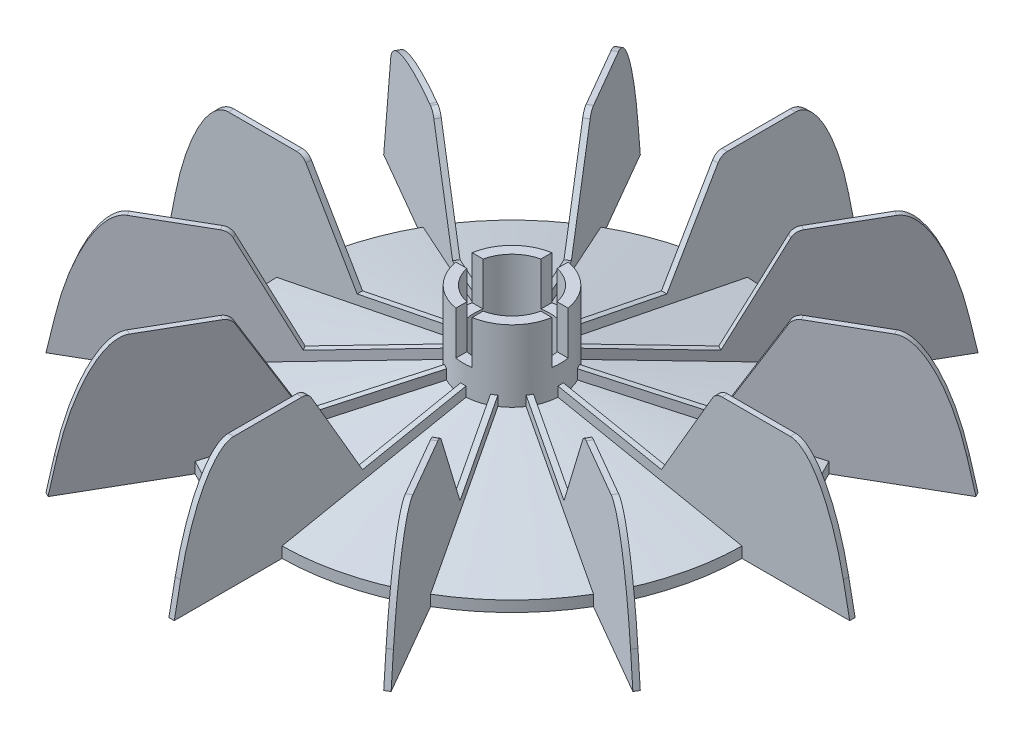
from build123d import *

# Parameters (mm, degrees)
SKETCH2_R            = 43
SKETCH2_R_2          = 7
BOSS_EXTRUDE1_DEPTH  = 10
SKETCH3_R            = 9
SKETCH3_R_2          = 7
BOSS_EXTRUDE2_DEPTH  = 12
CHAMFER1_SIZE        = 8
CHAMFER1_SIZE_2      = 40
BOSS_EXTRUDE12_DEPTH = 0.5
CIRPATTERN1_COUNT    = 12
FILLET1_START        = -0.5
FILLET1_DEPTH        = 1
FILLET1_2_DEPTH      = 1
FILLET1_3_DEPTH      = 1
FILLET1_4_DEPTH      = 1
FILLET1_5_DEPTH      = 1
FILLET1_6_DEPTH      = 1
FILLET2_R            = 2
CHAMFER2_SIZE        = 36.011878112
CHAMFER2_SIZE_2      = 7
SKETCH6_W            = 4.524645718
SKETCH6_H            = 3
CUT_EXTRUDE1_DEPTH   = 8
CIRPATTERN2_COUNT    = 4


with BuildPart() as part:
    # Sketch2 → Boss-Extrude1 (new body)
    with BuildSketch(Plane(origin=(0, 0, 0), x_dir=(1, 0, 0), z_dir=(0, 1, 0))):
        with Locations(Location((0, 0, 0), (0, 0, 270))):
            Circle(SKETCH2_R)
        with Locations(Location((0, 0, 0), (0, 0, 270))):
            Circle(SKETCH2_R_2, mode=Mode.SUBTRACT)
    extrude(amount=BOSS_EXTRUDE1_DEPTH)

    # Sketch3 → Boss-Extrude2 (add)
    with BuildSketch(Plane(origin=(0, 10, 0), x_dir=(1, 0, 0), z_dir=(0, 1, 0))):
        with Locations(Location((0, 0, 0), (0, 0, 270))):
            Circle(SKETCH3_R)
        with Locations(Location((0, 0, 0), (0, 0, 270))):
            Circle(SKETCH3_R_2, mode=Mode.SUBTRACT)
    extrude(amount=BOSS_EXTRUDE2_DEPTH)

    # Chamfer1
    # the kernel refuses this chamfer: 40, 8 mm, written as the material it takes off along each edge
    with BuildSketch(Plane(origin=(0, 10, 0), x_dir=(0, 0, 1), z_dir=(-1, 0, 0))) as chamfer1_piece_1_section:
        Polygon((43, -CHAMFER1_SIZE), (43 - CHAMFER1_SIZE_2, 0), (43, 0), align=None)
    chamfer1_piece_1 = revolve(axis=Axis((0, 10, 0), (0, 1, 0)), mode=Mode.PRIVATE)
    chamfer1_piece_1 = chamfer1_piece_1 - Plane(origin=(0, 10, 0), x_dir=(0, 0, 1), z_dir=(0, -1, 0)) * Cylinder(9, 172, mode=Mode.PRIVATE)
    add(chamfer1_piece_1, mode=Mode.SUBTRACT)

    # Sketch4 → Boss-Extrude12 (add, symmetric)
    with BuildSketch(Plane.XY):
        Polygon((-42.900844786, 0), (-62.900844786, 0), (-58.149544039, 24), (-38.149544039, 24), (-28.11392364, 6.774541358), (-7.964158813, 10.804494323), (-7.788591401, 8.8), (-42.900844786, 1.777549323), align=None)
    boss_extrude12 = extrude(amount=BOSS_EXTRUDE12_DEPTH, both=True)

    # CirPattern1: Boss-Extrude12 ×12 about axis
    cirpattern1_axis = Axis((0, 0, 0), (0, 1, 0))
    for i in range(1, CIRPATTERN1_COUNT):
        add(boss_extrude12.rotate(cirpattern1_axis, i * 360 / CIRPATTERN1_COUNT))

    # Fillet1: read off the stored shape, not the designer's step
    # Fillet1 outline → Fillet1 (cut)
    with BuildSketch(Plane(origin=(0, 0, 0), x_dir=(0.5000000000001382, 0, -0.8660254037843589), z_dir=(0.8660254037843589, 0, 0.500000000000138)).offset(FILLET1_START)):
        with BuildLine():
            add(Edge.make_bspline(
                [(61.724498316, 5.942018154), (58.149544039, 24), (51.914882345, 24)],
                knots=[0, 0, 0, 1, 1, 1], degree=2, weights=[1, 0.772723047, 1]))
            Line((61.724498316, 5.942018154), (58.149544039, 24))
            Line((58.149544039, 24), (51.914882345, 24))
        make_face()
        with BuildLine():
            Line((-58.149544039, 24), (-61.724498316, 5.942018154))
            add(Edge.make_bspline(
                [(-61.724498316, 5.942018154), (-58.149544039, 24), (-51.914882345, 24)],
                knots=[0, 0, 0, 1, 1, 1], degree=2, weights=[1, 0.772723047, 1]))
            Line((-51.914882345, 24), (-58.149544039, 24))
        make_face()
    extrude(amount=FILLET1_DEPTH, mode=Mode.SUBTRACT)

    # Fillet1 2 outline → Fillet1 2 (cut)
    with BuildSketch(Plane(origin=(0, 0, 0), x_dir=(0.8660254037844841, 0, -0.499999999999921), z_dir=(0.49999999999992106, 0, 0.8660254037844842)).offset(FILLET1_START)):
        with BuildLine():
            add(Edge.make_bspline(
                [(61.724498316, 5.942018154), (58.149544039, 24), (51.914882345, 24)],
                knots=[0, 0, 0, 1, 1, 1], degree=2, weights=[1, 0.772723047, 1]))
            Line((61.724498316, 5.942018154), (58.149544039, 24))
            Line((58.149544039, 24), (51.914882345, 24))
        make_face()
        with BuildLine():
            Line((-58.149544039, 24), (-61.724498316, 5.942018154))
            add(Edge.make_bspline(
                [(-61.724498316, 5.942018154), (-58.149544039, 24), (-51.914882345, 24)],
                knots=[0, 0, 0, 1, 1, 1], degree=2, weights=[1, 0.772723047, 1]))
            Line((-51.914882345, 24), (-58.149544039, 24))
        make_face()
    extrude(amount=FILLET1_2_DEPTH, mode=Mode.SUBTRACT)

    # Fillet1 3 outline → Fillet1 3 (cut)
    with BuildSketch(Plane.XY.offset(FILLET1_START)):
        with BuildLine():
            add(Edge.make_bspline(
                [(61.724498316, 5.942018154), (58.149544039, 24), (51.914882345, 24)],
                knots=[0, 0, 0, 1, 1, 1], degree=2, weights=[1, 0.772723047, 1]))
            Line((61.724498316, 5.942018154), (58.149544039, 24))
            Line((58.149544039, 24), (51.914882345, 24))
        make_face()
        with BuildLine():
            Line((-58.149544039, 24), (-61.724498316, 5.942018154))
            add(Edge.make_bspline(
                [(-61.724498316, 5.942018154), (-58.149544039, 24), (-51.914882345, 24)],
                knots=[0, 0, 0, 1, 1, 1], degree=2, weights=[1, 0.772723047, 1]))
            Line((-51.914882345, 24), (-58.149544039, 24))
        make_face()
    extrude(amount=FILLET1_3_DEPTH, mode=Mode.SUBTRACT)

    # Fillet1 4 outline → Fillet1 4 (cut)
    with BuildSketch(Plane(origin=(0, 0, 0), x_dir=(0.8660254037839025, 0, 0.5000000000009287), z_dir=(0.5000000000009287, 0, -0.8660254037839024)).offset(FILLET1_START)):
        with BuildLine():
            Line((58.149544039, -24), (61.724498316, -5.942018154))
            add(Edge.make_bspline(
                [(61.724498316, -5.942018154), (58.149544039, -24), (51.914882345, -24)],
                knots=[0, 0, 0, 1, 1, 1], degree=2, weights=[1, 0.772723047, 1]))
            Line((51.914882345, -24), (58.149544039, -24))
        make_face()
        with BuildLine():
            add(Edge.make_bspline(
                [(-59.360326658, -17.884036307), (-58.149544039, -24), (-39.741094717, -24)],
                knots=[0, 0, 0, 1, 1, 1], degree=2, weights=[1, 0.772723047, 1]))
            Line((-59.360326658, -17.884036307), (-58.149544039, -24))
            Line((-58.149544039, -24), (-39.741094717, -24))
        make_face()
    extrude(amount=FILLET1_4_DEPTH, mode=Mode.SUBTRACT)

    # Fillet1 5 outline → Fillet1 5 (cut)
    with BuildSketch(Plane(origin=(0, 0, 0), x_dir=(0.5000000000001099, 0, 0.8660254037843752), z_dir=(0.8660254037843752, 0, -0.5000000000001099)).offset(FILLET1_START)):
        with BuildLine():
            Line((58.149544039, -24), (61.724498316, -5.942018154))
            add(Edge.make_bspline(
                [(61.724498316, -5.942018154), (58.149544039, -24), (51.914882345, -24)],
                knots=[0, 0, 0, 1, 1, 1], degree=2, weights=[1, 0.772723047, 1]))
            Line((51.914882345, -24), (58.149544039, -24))
        make_face()
        with BuildLine():
            add(Edge.make_bspline(
                [(-61.724498316, -5.942018154), (-58.149544039, -24), (-51.914882345, -24)],
                knots=[0, 0, 0, 1, 1, 1], degree=2, weights=[1, 0.772723047, 1]))
            Line((-61.724498316, -5.942018154), (-58.149544039, -24))
            Line((-58.149544039, -24), (-51.914882345, -24))
        make_face()
    extrude(amount=FILLET1_5_DEPTH, mode=Mode.SUBTRACT)

    # Fillet1 6 outline → Fillet1 6 (cut)
    with BuildSketch(Plane.YZ.offset(FILLET1_START)):
        with BuildLine():
            Line((24, 58.149544039), (5.942018154, 61.724498316))
            add(Edge.make_bspline(
                [(5.942018154, 61.724498316), (24, 58.149544039), (24, 51.914882345)],
                knots=[0, 0, 0, 1, 1, 1], degree=2, weights=[1, 0.772723047, 1]))
            Line((24, 51.914882345), (24, 58.149544039))
        make_face()
        with BuildLine():
            add(Edge.make_bspline(
                [(5.942018154, -61.724498316), (24, -58.149544039), (24, -51.914882345)],
                knots=[0, 0, 0, 1, 1, 1], degree=2, weights=[1, 0.772723047, 1]))
            Line((5.942018154, -61.724498316), (24, -58.149544039))
            Line((24, -58.149544039), (24, -51.914882345))
        make_face()
    extrude(amount=FILLET1_6_DEPTH, mode=Mode.SUBTRACT)

    # Fillet2
    fillet2_edges = [part.edges().sort_by_distance(p)[0] for p in [
        (19.07477202, 24, 33.038474281),
        (33.038474281, 24, 19.07477202),
        (38.149544039, 24, 0),
        (33.038474281, 24, -19.07477202),
        (19.07477202, 24, -33.038474281),
        (0, 24, -38.149544039),
        (-19.07477202, 24, -33.038474281),
        (-33.038474281, 24, -19.07477202),
        (-38.149544039, 24, 0),
        (-33.038474281, 24, 19.07477202),
        (-19.07477202, 24, 33.038474281),
        (0, 24, 38.149544039),
    ]]
    fillet(fillet2_edges, radius=FILLET2_R)

    # Chamfer2
    # the kernel refuses this chamfer: 36.011878112, 7 mm, written as the material it takes off along each edge
    with BuildSketch(Plane(origin=(0, 0, 0), x_dir=(0, 0, 1), z_dir=(-1, 0, 0))) as chamfer2_piece_1:
        Polygon((7 + CHAMFER2_SIZE, 0), (7, CHAMFER2_SIZE_2), (7, 0), align=None)
    revolve(axis=Axis((0, 0, 0), (0, 1, 0)), mode=Mode.SUBTRACT)

    # Sketch6 → Cut-Extrude1 (cut)
    with BuildSketch(Plane(origin=(0, 22, 0), x_dir=(1, 0, 0), z_dir=(0, 1, 0))):
        with Locations((-7.717562861, 0)):
            Rectangle(SKETCH6_W, SKETCH6_H)
    cut_extrude1 = extrude(amount=-CUT_EXTRUDE1_DEPTH, mode=Mode.SUBTRACT)

    # CirPattern2: Cut-Extrude1 ×4 about axis
    cirpattern2_axis = Axis((0, 0, 0), (0, 1, 0))
    for i in range(1, CIRPATTERN2_COUNT):
        add(cut_extrude1.rotate(cirpattern2_axis, i * 360 / CIRPATTERN2_COUNT), mode=Mode.SUBTRACT)


solid = part.part
